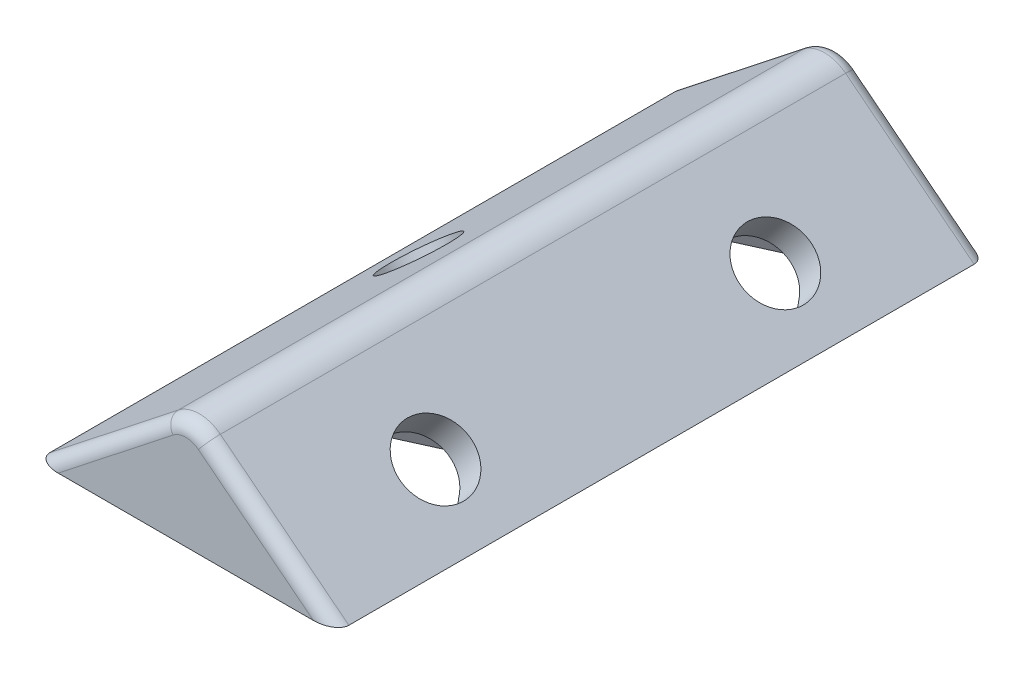
from build123d import *

# Parameters (mm, degrees)
BOSS_EXTRUDE3_DEPTH = 48
SKETCH4_R           = 2.625
CUT_EXTRUDE2_DEPTH  = 51.1141554
SKETCH5_R           = 2.625
CUT_EXTRUDE3_DEPTH  = 51.1141554
FILLET2_R           = 2.5
CUT_EXTRUDE4_DEPTH  = 12.5
CUT_EXTRUDE6_DEPTH  = 12.5
FILLET3_R           = 1
FILLET4_R           = 1


with BuildPart() as part:
    # Sketch2 → Boss-Extrude3 (new body)
    with BuildSketch(Plane.XY):
        Polygon((0, 2.309401077), (-11, -6.350852961), (11, -6.350852961), align=None)
    extrude(amount=BOSS_EXTRUDE3_DEPTH)

    # Sketch4 → Cut-Extrude2 (cut, through all)
    with BuildSketch(Plane(origin=(-1.12244898, 1.425701685, 0), x_dir=(0.7857142857142814, 0.6185895741317475, 0), z_dir=(-0.6185895741317475, 0.7857142857142814, 0))):
        with Locations((-7.321428571, -24)):
            Circle(SKETCH4_R)
    extrude(amount=-CUT_EXTRUDE2_DEPTH, mode=Mode.SUBTRACT)

    # Sketch5 → Cut-Extrude3 (cut, through all)
    with BuildSketch(Plane(origin=(1.12244898, 1.425701685, 0), x_dir=(0.7857142857142887, -0.6185895741317382, 0), z_dir=(0.6185895741317382, 0.7857142857142888, 0))):
        with Locations((7.321428571, -11.5)):
            Circle(SKETCH5_R)
        with Locations((7.321428571, -36.5)):
            Circle(SKETCH5_R)
    extrude(amount=-CUT_EXTRUDE3_DEPTH, mode=Mode.SUBTRACT)

    # Fillet2
    fillet2_edges = [part.edges().sort_by_distance(p)[0] for p in [
        (0, 2.309401077, 24),
    ]]
    fillet(fillet2_edges, radius=FILLET2_R)

    # Sketch6 → Cut-Extrude4 (cut)
    with BuildSketch(Plane(origin=(-8.156394632, -10.360012601, 0), x_dir=(0.7857142857142887, -0.6185895741317382, 0), z_dir=(0.6185895741317382, 0.7857142857142888, 0))):
        Polygon((7.321428571, -6.82346282), (3.271428571, -9.16173141), (3.271428571, -13.83826859), (7.321428571, -16.17653718), (11.371428571, -13.83826859), (11.371428571, -9.16173141), align=None)
        Polygon((7.321428571, -31.82346282), (3.271428571, -34.16173141), (3.271428571, -38.83826859), (7.321428571, -41.17653718), (11.371428571, -38.83826859), (11.371428571, -34.16173141), align=None)
    extrude(amount=CUT_EXTRUDE4_DEPTH, mode=Mode.SUBTRACT)

    # Sketch7 → Cut-Extrude6 (cut)
    with BuildSketch(Plane(origin=(8.156394632, -10.360012601, 0), x_dir=(0.7857142857142814, 0.6185895741317475, 0), z_dir=(-0.6185895741317475, 0.7857142857142814, 0))):
        Polygon((-7.321428571, -19.32346282), (-11.371428571, -21.66173141), (-11.371428571, -26.33826859), (-7.321428571, -28.67653718), (-3.271428571, -26.33826859), (-3.271428571, -21.66173141), align=None)
    extrude(amount=CUT_EXTRUDE6_DEPTH, mode=Mode.SUBTRACT)

    # Fillet3
    fillet3_edges = [part.edges().sort_by_distance(p)[0] for p in [
        (-6.273236968, -2.629492176, 0),
        (0, 1.627582895, 0),
        (6.273236968, -2.629492176, 0),
    ]]
    fillet(fillet3_edges, radius=FILLET3_R)

    # Fillet4
    fillet4_edges = [part.edges().sort_by_distance(p)[0] for p in [
        (-6.273236968, -2.629492176, 48),
        (0, 1.627582895, 48),
        (6.273236968, -2.629492176, 48),
    ]]
    fillet(fillet4_edges, radius=FILLET4_R)


solid = part.part
